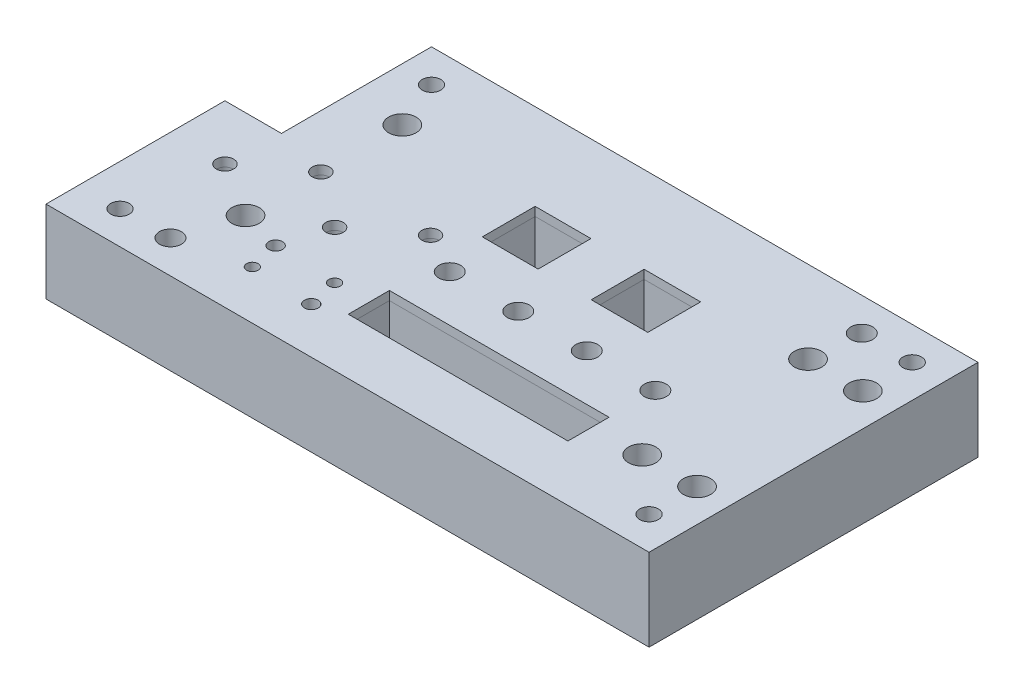
from build123d import *

# Parameters (mm, degrees)
SKETCH1_W                    = 220
SKETCH1_H                    = 120
BOSS_EXTRUDE1_DEPTH          = 30
CUT_EXTRUDE1_REACH           = 130.841
SKETCH2_W                    = 20.632503002
SKETCH2_H                    = 54.730004003
CUT_EXTRUDE3_REACH           = 130.841
SKETCH5_W                    = 20.37
SKETCH5_H                    = 19.28
SKETCH5_W_2                  = 20.62
F_0_15_6_32_DIAMETER_HOLE1_D = 6.32
CUT_EXTRUDE4_REACH           = 130.841
SKETCH10_W                   = 80.12
SKETCH10_H                   = 15
CUT_EXTRUDE5_REACH           = 130.841
SKETCH12_R                   = 5
SKETCH12_R_2                 = 4
SKETCH13_R                   = 6.25
CUT_EXTRUDE6_DEPTH           = 20
SKETCH14_R                   = 5
CUT_EXTRUDE7_DEPTH           = 20
M5_TAPPED_HOLE1_D            = 4.2
M5_TAPPED_HOLE1_DEPTH        = 14
M5_TAPPED_HOLE1_TIP          = 1.2618073
F_5_0MM_DOWEL_HOLE1_D        = 5
M8_TAPPED_HOLE1_D            = 6.8
F_8_0MM_DOWEL_HOLE1_D        = 8


with BuildPart() as part:
    # Sketch1 → Boss-Extrude1 (new body)
    with BuildSketch(Plane(origin=(0, 0, 0), x_dir=(1, 0, 0), z_dir=(0, 1, 0))):
        Rectangle(SKETCH1_W, SKETCH1_H)
    extrude(amount=-BOSS_EXTRUDE1_DEPTH)

    # Sketch2 → Cut-Extrude1 (cut, up to next)
    with BuildSketch(Plane(origin=(0, 0, 0), x_dir=(1, 0, 0), z_dir=(0, 1, 0)), mode=Mode.PRIVATE) as cut_extrude1_sk1:
        with Locations((-99.683748499, 32.634997999)):
            Rectangle(SKETCH2_W, SKETCH2_H)
    cut_extrude1_tool1 = extrude(cut_extrude1_sk1.sketch, amount=-CUT_EXTRUDE1_REACH, mode=Mode.PRIVATE) & part.part
    add(cut_extrude1_tool1.solids().sort_by_distance((-99.683748, 0, -32.634998))[0], mode=Mode.SUBTRACT)

    # Sketch5 → Cut-Extrude3 (cut, up to next)
    with BuildSketch(Plane(origin=(0, 0, 0), x_dir=(1, 0, 0), z_dir=(0, 1, 0)), mode=Mode.PRIVATE) as cut_extrude3_sk1:
        with Locations((-9.875, 18.86)):
            Rectangle(SKETCH5_W, SKETCH5_H)
    cut_extrude3_tool1 = extrude(cut_extrude3_sk1.sketch, amount=-CUT_EXTRUDE3_REACH, mode=Mode.PRIVATE) & part.part
    # Sketch5 → Cut-Extrude3 (cut, up to next)
    with BuildSketch(Plane(origin=(0, 0, 0), x_dir=(1, 0, 0), z_dir=(0, 1, 0)), mode=Mode.PRIVATE) as cut_extrude3_sk2:
        with Locations((30, 18.86)):
            Rectangle(SKETCH5_W_2, SKETCH5_H)
    cut_extrude3_tool2 = extrude(cut_extrude3_sk2.sketch, amount=-CUT_EXTRUDE3_REACH, mode=Mode.PRIVATE) & part.part
    add(cut_extrude3_tool1.solids().sort_by_distance((-9.875, 0, -18.86))[0], mode=Mode.SUBTRACT)
    add(cut_extrude3_tool2.solids().sort_by_distance((30, 0, -18.86))[0], mode=Mode.SUBTRACT)

    # Ø0.15 (6.32) Diameter Hole1 (through all)
    with Locations(Plane(origin=(0, 0, 0), x_dir=(1, 0, 0), z_dir=(0, 1, 0))):
        with Locations((-30, 0.28), (-50, -14.72), (-70, 0.28), (-90, -14.72)):
            Hole(F_0_15_6_32_DIAMETER_HOLE1_D / 2)

    # Sketch10 → Cut-Extrude4 (cut, up to next)
    with BuildSketch(Plane(origin=(0, 0, 0), x_dir=(1, 0, 0), z_dir=(0, 1, 0)), mode=Mode.PRIVATE) as cut_extrude4_sk1:
        with Locations((20, -32.16)):
            Rectangle(SKETCH10_W, SKETCH10_H)
    cut_extrude4_tool1 = extrude(cut_extrude4_sk1.sketch, amount=-CUT_EXTRUDE4_REACH, mode=Mode.PRIVATE) & part.part
    add(cut_extrude4_tool1.solids().sort_by_distance((20, 0, 32.16))[0], mode=Mode.SUBTRACT)

    # Draft1: read off the stored shape, not the designer's step
    # Draft1: loft between two sections, ruled curve by curve
    draft1_from = [
        Edge.make_line((40.31, -3.2, -9.22), (40.31, -3.2, -28.5)),
        Edge.make_line((19.69, -3.2, -9.22), (40.31, -3.2, -9.22)),
        Edge.make_line((19.69, -3.2, -28.5), (19.69, -3.2, -9.22)),
        Edge.make_line((40.31, -3.2, -28.5), (19.69, -3.2, -28.5)),
    ]
    draft1_to = [
        Edge.make_line((40.77779574, -30, -8.75220426), (40.77779574, -30, -28.96779574)),
        Edge.make_line((19.22220426, -30, -8.75220426), (40.77779574, -30, -8.75220426)),
        Edge.make_line((19.22220426, -30, -28.96779574), (19.22220426, -30, -8.75220426)),
        Edge.make_line((40.77779574, -30, -28.96779574), (19.22220426, -30, -28.96779574)),
    ]
    draft1 = Solid(Shell([*[Face.make_surface_from_curves(draft1_from[k], draft1_to[k]) for k in range(4)], Face(Wire(draft1_from)), Face(Wire(draft1_to))]))
    add(draft1, mode=Mode.SUBTRACT)

    # Draft1 2: loft between two sections, ruled curve by curve
    draft1_2_from = [
        Edge.make_line((-20.06, -3.2, -9.22), (0.31, -3.2, -9.22)),
        Edge.make_line((0.31, -3.2, -28.5), (-20.06, -3.2, -28.5)),
        Edge.make_line((0.31, -3.2, -9.22), (0.31, -3.2, -28.5)),
        Edge.make_line((-20.06, -3.2, -28.5), (-20.06, -3.2, -9.22)),
    ]
    draft1_2_to = [
        Edge.make_line((-20.52779574, -30, -8.75220426), (0.77779574, -30, -8.75220426)),
        Edge.make_line((0.77779574, -30, -28.96779574), (-20.52779574, -30, -28.96779574)),
        Edge.make_line((0.77779574, -30, -8.75220426), (0.77779574, -30, -28.96779574)),
        Edge.make_line((-20.52779574, -30, -28.96779574), (-20.52779574, -30, -8.75220426)),
    ]
    draft1_2 = Solid(Shell([*[Face.make_surface_from_curves(draft1_2_from[k], draft1_2_to[k]) for k in range(4)], Face(Wire(draft1_2_from)), Face(Wire(draft1_2_to))]))
    add(draft1_2, mode=Mode.SUBTRACT)

    # Draft1 3: loft between two sections, ruled curve by curve
    draft1_3_from = [
        Edge.make_line((-20.06, -3.2, 24.66), (-20.06, -3.2, 39.66)),
        Edge.make_line((60.06, -3.2, 24.66), (-20.06, -3.2, 24.66)),
        Edge.make_line((60.06, -3.2, 39.66), (60.06, -3.2, 24.66)),
        Edge.make_line((-20.06, -3.2, 39.66), (60.06, -3.2, 39.66)),
    ]
    draft1_3_to = [
        Edge.make_line((-20.52779574, -30, 24.19220426), (-20.52779574, -30, 40.12779574)),
        Edge.make_line((60.52779574, -30, 24.19220426), (-20.52779574, -30, 24.19220426)),
        Edge.make_line((60.52779574, -30, 40.12779574), (60.52779574, -30, 24.19220426)),
        Edge.make_line((-20.52779574, -30, 40.12779574), (60.52779574, -30, 40.12779574)),
    ]
    draft1_3 = Solid(Shell([*[Face.make_surface_from_curves(draft1_3_from[k], draft1_3_to[k]) for k in range(4)], Face(Wire(draft1_3_from)), Face(Wire(draft1_3_to))]))
    add(draft1_3, mode=Mode.SUBTRACT)

    # Draft2: read off the stored shape, not the designer's step
    # Draft2: loft between two sections, ruled curve by curve
    draft2_from = [
        Edge.make_three_point_arc((-90, -3.2, 11.56), (-86.84, -3.2, 14.72), (-90, -3.2, 17.88)),
        Edge.make_three_point_arc((-90, -3.2, 17.88), (-93.16, -3.2, 14.72), (-90, -3.2, 11.56)),
    ]
    draft2_to = [
        Edge.make_three_point_arc((-90, -30, 11.09220426), (-86.37220426, -30, 14.72), (-90, -30, 18.34779574)),
        Edge.make_three_point_arc((-90, -30, 18.34779574), (-93.62779574, -30, 14.72), (-90, -30, 11.09220426)),
    ]
    draft2 = Solid(Shell([*[Face.make_surface_from_curves(draft2_from[k], draft2_to[k]) for k in range(2)], Face(Wire(draft2_from)), Face(Wire(draft2_to))]))
    add(draft2, mode=Mode.SUBTRACT)

    # Draft2 2: loft between two sections, ruled curve by curve
    draft2_2_from = [
        Edge.make_three_point_arc((-70, -3.2, -3.44), (-66.84, -3.2, -0.28), (-70, -3.2, 2.88)),
        Edge.make_three_point_arc((-70, -3.2, 2.88), (-73.16, -3.2, -0.28), (-70, -3.2, -3.44)),
    ]
    draft2_2_to = [
        Edge.make_three_point_arc((-70, -30, -3.90779574), (-66.37220426, -30, -0.28), (-70, -30, 3.34779574)),
        Edge.make_three_point_arc((-70, -30, 3.34779574), (-73.62779574, -30, -0.28), (-70, -30, -3.90779574)),
    ]
    draft2_2 = Solid(Shell([*[Face.make_surface_from_curves(draft2_2_from[k], draft2_2_to[k]) for k in range(2)], Face(Wire(draft2_2_from)), Face(Wire(draft2_2_to))]))
    add(draft2_2, mode=Mode.SUBTRACT)

    # Draft2 3: loft between two sections, ruled curve by curve
    draft2_3_from = [
        Edge.make_three_point_arc((-50, -3.2, 11.56), (-46.84, -3.2, 14.72), (-50, -3.2, 17.88)),
        Edge.make_three_point_arc((-50, -3.2, 17.88), (-53.16, -3.2, 14.72), (-50, -3.2, 11.56)),
    ]
    draft2_3_to = [
        Edge.make_three_point_arc((-50, -30, 11.09220426), (-46.37220426, -30, 14.72), (-50, -30, 18.34779574)),
        Edge.make_three_point_arc((-50, -30, 18.34779574), (-53.62779574, -30, 14.72), (-50, -30, 11.09220426)),
    ]
    draft2_3 = Solid(Shell([*[Face.make_surface_from_curves(draft2_3_from[k], draft2_3_to[k]) for k in range(2)], Face(Wire(draft2_3_from)), Face(Wire(draft2_3_to))]))
    add(draft2_3, mode=Mode.SUBTRACT)

    # Draft2 4: loft between two sections, ruled curve by curve
    draft2_4_from = [
        Edge.make_three_point_arc((-30, -3.2, -3.44), (-26.84, -3.2, -0.28), (-30, -3.2, 2.88)),
        Edge.make_three_point_arc((-30, -3.2, 2.88), (-33.16, -3.2, -0.28), (-30, -3.2, -3.44)),
    ]
    draft2_4_to = [
        Edge.make_three_point_arc((-30, -30, -3.90779574), (-26.37220426, -30, -0.28), (-30, -30, 3.34779574)),
        Edge.make_three_point_arc((-30, -30, 3.34779574), (-33.62779574, -30, -0.28), (-30, -30, -3.90779574)),
    ]
    draft2_4 = Solid(Shell([*[Face.make_surface_from_curves(draft2_4_from[k], draft2_4_to[k]) for k in range(2)], Face(Wire(draft2_4_from)), Face(Wire(draft2_4_to))]))
    add(draft2_4, mode=Mode.SUBTRACT)

    # Sketch12 → Cut-Extrude5 (cut, up to next)
    with BuildSketch(Plane(origin=(0, 0, 0), x_dir=(1, 0, 0), z_dir=(0, 1, 0)), mode=Mode.PRIVATE) as cut_extrude5_sk1:
        with Locations(Location((-70, 30, 0), (0, 0, 270))):
            Circle(SKETCH12_R)
    cut_extrude5_tool1 = extrude(cut_extrude5_sk1.sketch, amount=-CUT_EXTRUDE5_REACH, mode=Mode.PRIVATE) & part.part
    # Sketch12 → Cut-Extrude5 (cut, up to next)
    with BuildSketch(Plane(origin=(0, 0, 0), x_dir=(1, 0, 0), z_dir=(0, 1, 0)), mode=Mode.PRIVATE) as cut_extrude5_sk2:
        with Locations(Location((98, -30.5, 0), (0, 0, 270))):
            Circle(SKETCH12_R)
    cut_extrude5_tool2 = extrude(cut_extrude5_sk2.sketch, amount=-CUT_EXTRUDE5_REACH, mode=Mode.PRIVATE) & part.part
    # Sketch12 → Cut-Extrude5 (cut, up to next)
    with BuildSketch(Plane(origin=(0, 0, 0), x_dir=(1, 0, 0), z_dir=(0, 1, 0)), mode=Mode.PRIVATE) as cut_extrude5_sk3:
        with Locations(Location((98, 30, 0), (0, 0, 270))):
            Circle(SKETCH12_R)
    cut_extrude5_tool3 = extrude(cut_extrude5_sk3.sketch, amount=-CUT_EXTRUDE5_REACH, mode=Mode.PRIVATE) & part.part
    # Sketch12 → Cut-Extrude5 (cut, up to next)
    with BuildSketch(Plane(origin=(0, 0, 0), x_dir=(1, 0, 0), z_dir=(0, 1, 0)), mode=Mode.PRIVATE) as cut_extrude5_sk4:
        with Locations(Location((78, 30, 0), (0, 0, 270))):
            Circle(SKETCH12_R)
    cut_extrude5_tool4 = extrude(cut_extrude5_sk4.sketch, amount=-CUT_EXTRUDE5_REACH, mode=Mode.PRIVATE) & part.part
    # Sketch12 → Cut-Extrude5 (cut, up to next)
    with BuildSketch(Plane(origin=(0, 0, 0), x_dir=(1, 0, 0), z_dir=(0, 1, 0)), mode=Mode.PRIVATE) as cut_extrude5_sk5:
        with Locations(Location((10, -7.72, 0), (0, 0, 270))):
            Circle(SKETCH12_R_2)
    cut_extrude5_tool5 = extrude(cut_extrude5_sk5.sketch, amount=-CUT_EXTRUDE5_REACH, mode=Mode.PRIVATE) & part.part
    # Sketch12 → Cut-Extrude5 (cut, up to next)
    with BuildSketch(Plane(origin=(0, 0, 0), x_dir=(1, 0, 0), z_dir=(0, 1, 0)), mode=Mode.PRIVATE) as cut_extrude5_sk6:
        with Locations(Location((35, -7.72, 0), (0, 0, 270))):
            Circle(SKETCH12_R_2)
    cut_extrude5_tool6 = extrude(cut_extrude5_sk6.sketch, amount=-CUT_EXTRUDE5_REACH, mode=Mode.PRIVATE) & part.part
    # Sketch12 → Cut-Extrude5 (cut, up to next)
    with BuildSketch(Plane(origin=(0, 0, 0), x_dir=(1, 0, 0), z_dir=(0, 1, 0)), mode=Mode.PRIVATE) as cut_extrude5_sk7:
        with Locations(Location((60, -7.72, 0), (0, 0, 270))):
            Circle(SKETCH12_R_2)
    cut_extrude5_tool7 = extrude(cut_extrude5_sk7.sketch, amount=-CUT_EXTRUDE5_REACH, mode=Mode.PRIVATE) & part.part
    # Sketch12 → Cut-Extrude5 (cut, up to next)
    with BuildSketch(Plane(origin=(0, 0, 0), x_dir=(1, 0, 0), z_dir=(0, 1, 0)), mode=Mode.PRIVATE) as cut_extrude5_sk8:
        with Locations(Location((-70, -27.22, 0), (0, 0, 270))):
            Circle(SKETCH12_R)
    cut_extrude5_tool8 = extrude(cut_extrude5_sk8.sketch, amount=-CUT_EXTRUDE5_REACH, mode=Mode.PRIVATE) & part.part
    # Sketch12 → Cut-Extrude5 (cut, up to next)
    with BuildSketch(Plane(origin=(0, 0, 0), x_dir=(1, 0, 0), z_dir=(0, 1, 0)), mode=Mode.PRIVATE) as cut_extrude5_sk9:
        with Locations(Location((78, -30.5, 0), (0, 0, 270))):
            Circle(SKETCH12_R)
    cut_extrude5_tool9 = extrude(cut_extrude5_sk9.sketch, amount=-CUT_EXTRUDE5_REACH, mode=Mode.PRIVATE) & part.part
    # Sketch12 → Cut-Extrude5 (cut, up to next)
    with BuildSketch(Plane(origin=(0, 0, 0), x_dir=(1, 0, 0), z_dir=(0, 1, 0)), mode=Mode.PRIVATE) as cut_extrude5_sk10:
        with Locations(Location((-15, -7.72, 0), (0, 0, 270))):
            Circle(SKETCH12_R_2)
    cut_extrude5_tool10 = extrude(cut_extrude5_sk10.sketch, amount=-CUT_EXTRUDE5_REACH, mode=Mode.PRIVATE) & part.part
    add(cut_extrude5_tool1.solids().sort_by_distance((-70, 0, -30))[0], mode=Mode.SUBTRACT)
    add(cut_extrude5_tool2.solids().sort_by_distance((98, 0, 30.5))[0], mode=Mode.SUBTRACT)
    add(cut_extrude5_tool3.solids().sort_by_distance((98, 0, -30))[0], mode=Mode.SUBTRACT)
    add(cut_extrude5_tool4.solids().sort_by_distance((78, 0, -30))[0], mode=Mode.SUBTRACT)
    add(cut_extrude5_tool5.solids().sort_by_distance((10, 0, 7.72))[0], mode=Mode.SUBTRACT)
    add(cut_extrude5_tool6.solids().sort_by_distance((35, 0, 7.72))[0], mode=Mode.SUBTRACT)
    add(cut_extrude5_tool7.solids().sort_by_distance((60, 0, 7.72))[0], mode=Mode.SUBTRACT)
    add(cut_extrude5_tool8.solids().sort_by_distance((-70, 0, 27.22))[0], mode=Mode.SUBTRACT)
    add(cut_extrude5_tool9.solids().sort_by_distance((78, 0, 30.5))[0], mode=Mode.SUBTRACT)
    add(cut_extrude5_tool10.solids().sort_by_distance((-15, 0, 7.72))[0], mode=Mode.SUBTRACT)

    # Sketch13 → Cut-Extrude6 (cut)
    with BuildSketch(Plane.XZ.offset(30)):
        with Locations(Location((-70, 27.22, 0), (0, 0, 270))):
            Circle(SKETCH13_R)
        with Locations(Location((78, 30.5, 0), (0, 0, 270))):
            Circle(SKETCH13_R)
        with Locations(Location((98, 30.5, 0), (0, 0, 270))):
            Circle(SKETCH13_R)
        with Locations(Location((98, -30, 0), (0, 0, 270))):
            Circle(SKETCH13_R)
        with Locations(Location((78, -30, 0), (0, 0, 270))):
            Circle(SKETCH13_R)
        with Locations(Location((-70, -30, 0), (0, 0, 270))):
            Circle(SKETCH13_R)
    extrude(amount=-CUT_EXTRUDE6_DEPTH, mode=Mode.SUBTRACT)

    # Sketch14 → Cut-Extrude7 (cut)
    with BuildSketch(Plane.XZ.offset(30)):
        with Locations(Location((-15, 7.72, 0), (0, 0, 270))):
            Circle(SKETCH14_R)
        with Locations(Location((10, 7.72, 0), (0, 0, 270))):
            Circle(SKETCH14_R)
        with Locations(Location((35, 7.72, 0), (0, 0, 270))):
            Circle(SKETCH14_R)
        with Locations(Location((60, 7.72, 0), (0, 0, 270))):
            Circle(SKETCH14_R)
    extrude(amount=-CUT_EXTRUDE7_DEPTH, mode=Mode.SUBTRACT)

    # M5 Tapped Hole1
    with Locations(Plane(origin=(0, 0, 0), x_dir=(1, 0, 0), z_dir=(0, 1, 0))):
        with Locations((-52.5, -42.22), (-32.5, -32.22)):
            Hole(M5_TAPPED_HOLE1_D / 2, depth=M5_TAPPED_HOLE1_DEPTH)
            with Locations((0, 0, -(M5_TAPPED_HOLE1_DEPTH + M5_TAPPED_HOLE1_TIP / 2))):  # 118° drill point
                Cone(0, M5_TAPPED_HOLE1_D / 2, M5_TAPPED_HOLE1_TIP, mode=Mode.SUBTRACT)

    # Ø5.0mm Dowel Hole1 (through all)
    with Locations(Plane(origin=(0, 0, 0), x_dir=(1, 0, 0), z_dir=(0, 1, 0))):
        with Locations((-30, -43.22), (-55, -31.22)):
            Hole(F_5_0MM_DOWEL_HOLE1_D / 2)

    # M8 Tapped Hole1 (through all)
    with Locations(Plane(origin=(0, -30, 0), x_dir=(-1, 0, 0), z_dir=(0, -1, 0))):
        with Locations((-98, 48), (-98, -48), (95, -48), (77.367496998, 48)):
            Hole(M8_TAPPED_HOLE1_D / 2)

    # Ø8.0mm Dowel Hole1 (through all)
    with Locations(Plane(origin=(0, -30, 0), x_dir=(-1, 0, 0), z_dir=(0, -1, 0))):
        with Locations((-79.6, 48), (76.6, -48)):
            Hole(F_8_0MM_DOWEL_HOLE1_D / 2)


solid = part.part
